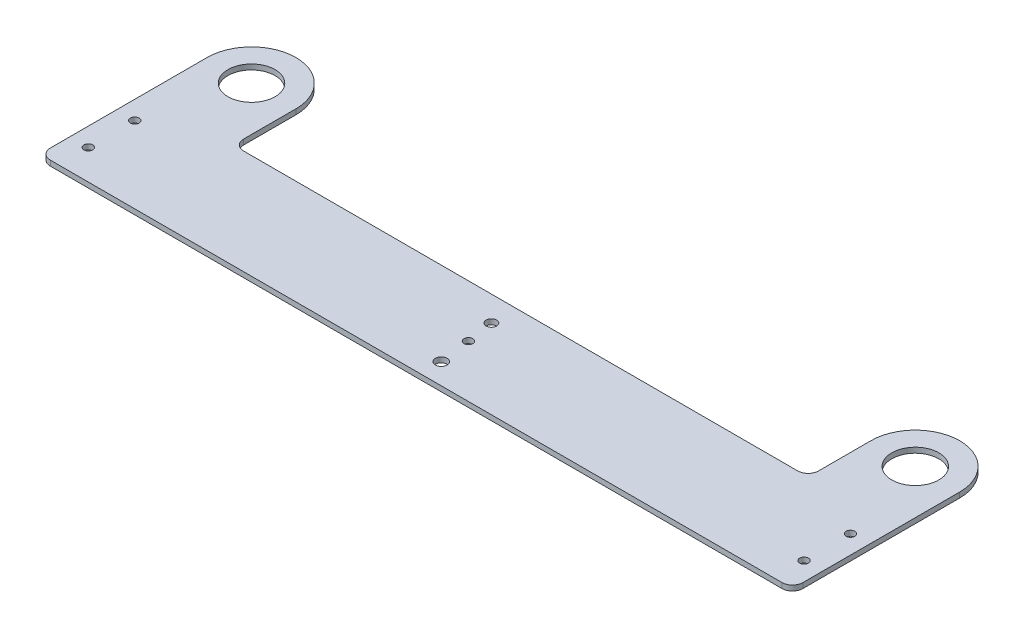
from build123d import *

# Parameters (mm, degrees)
SKETCH1_R           = 14.2875
BOSS_EXTRUDE1_DEPTH = 3.175
CUT_EXTRUDE1_REACH  = 444.058
SKETCH2_R           = 3.556
SKETCH2_R_2         = 3.175
CUT_EXTRUDE2_REACH  = 444.058
SKETCH3_R           = 2.667
CUT_EXTRUDE3_REACH  = 444.058
SKETCH4_R           = 2.667


with BuildPart() as part:
    # Sketch1 → Boss-Extrude1 (new body)
    with BuildSketch(Plane(origin=(0, 0, 0), x_dir=(1, 0, 0), z_dir=(0, 1, 0))):
        with BuildLine():
            Line((-26.9875, 0), (-26.9875, -95.25))
            ThreePointArc((-26.9875, -95.25), (-25.127628061, -99.740128061), (-20.6375, -101.6))
            Line((-20.6375, -101.6), (423.8625, -101.6))
            ThreePointArc((423.8625, -101.6), (428.352628061, -99.740128061), (430.2125, -95.25))
            Line((430.2125, -95.25), (430.2125, 0))
            ThreePointArc((430.2125, 0), (403.225, 26.9875), (376.2375, 0))
            Line((376.2375, 0), (376.2375, -31.75))
            ThreePointArc((376.2375, -31.75), (374.377628061, -36.240128061), (369.8875, -38.1))
            Line((369.8875, -38.1), (33.3375, -38.1))
            ThreePointArc((33.3375, -38.1), (28.847371939, -36.240128061), (26.9875, -31.75))
            Line((26.9875, -31.75), (26.9875, 0))
            ThreePointArc((26.9875, 0), (0, 26.9875), (-26.9875, 0))
        make_face()
        Circle(SKETCH1_R, mode=Mode.SUBTRACT)
        with Locations((403.225, 0)):
            Circle(SKETCH1_R, mode=Mode.SUBTRACT)
    extrude(amount=BOSS_EXTRUDE1_DEPTH)

    # Sketch2 → Cut-Extrude1 (cut, up to next)
    with BuildSketch(Plane(origin=(0, 3.175, 0), x_dir=(1, 0, 0), z_dir=(0, 1, 0)), mode=Mode.PRIVATE) as cut_extrude1_sk1:
        with Locations((204.1525, -88.9)):
            Circle(SKETCH2_R)
    cut_extrude1_tool1 = extrude(cut_extrude1_sk1.sketch, amount=-CUT_EXTRUDE1_REACH, mode=Mode.PRIVATE) & part.part
    # Sketch2 → Cut-Extrude1 (cut, up to next)
    with BuildSketch(Plane(origin=(0, 3.175, 0), x_dir=(1, 0, 0), z_dir=(0, 1, 0)), mode=Mode.PRIVATE) as cut_extrude1_sk2:
        with Locations((199.0725, -53.34)):
            Circle(SKETCH2_R_2)
    cut_extrude1_tool2 = extrude(cut_extrude1_sk2.sketch, amount=-CUT_EXTRUDE1_REACH, mode=Mode.PRIVATE) & part.part
    add(cut_extrude1_tool1.solids().sort_by_distance((204.1525, 3.175, 88.9))[0], mode=Mode.SUBTRACT)
    add(cut_extrude1_tool2.solids().sort_by_distance((199.0725, 3.175, 53.34))[0], mode=Mode.SUBTRACT)

    # Sketch3 → Cut-Extrude2 (cut, up to next)
    with BuildSketch(Plane(origin=(0, 3.175, 0), x_dir=(1, 0, 0), z_dir=(0, 1, 0)), mode=Mode.PRIVATE) as cut_extrude2_sk1:
        with Locations((-15.779743521, -55.159030044)):
            Circle(SKETCH3_R)
    cut_extrude2_tool1 = extrude(cut_extrude2_sk1.sketch, amount=-CUT_EXTRUDE2_REACH, mode=Mode.PRIVATE) & part.part
    # Sketch3 → Cut-Extrude2 (cut, up to next)
    with BuildSketch(Plane(origin=(0, 3.175, 0), x_dir=(1, 0, 0), z_dir=(0, 1, 0)), mode=Mode.PRIVATE) as cut_extrude2_sk2:
        with Locations((419.004743521, -55.159030044)):
            Circle(SKETCH3_R)
    cut_extrude2_tool2 = extrude(cut_extrude2_sk2.sketch, amount=-CUT_EXTRUDE2_REACH, mode=Mode.PRIVATE) & part.part
    # Sketch3 → Cut-Extrude2 (cut, up to next)
    with BuildSketch(Plane(origin=(0, 3.175, 0), x_dir=(1, 0, 0), z_dir=(0, 1, 0)), mode=Mode.PRIVATE) as cut_extrude2_sk3:
        with Locations((-15.779743521, -83.371493131)):
            Circle(SKETCH3_R)
    cut_extrude2_tool3 = extrude(cut_extrude2_sk3.sketch, amount=-CUT_EXTRUDE2_REACH, mode=Mode.PRIVATE) & part.part
    # Sketch3 → Cut-Extrude2 (cut, up to next)
    with BuildSketch(Plane(origin=(0, 3.175, 0), x_dir=(1, 0, 0), z_dir=(0, 1, 0)), mode=Mode.PRIVATE) as cut_extrude2_sk4:
        with Locations((419.004743521, -83.371493131)):
            Circle(SKETCH3_R)
    cut_extrude2_tool4 = extrude(cut_extrude2_sk4.sketch, amount=-CUT_EXTRUDE2_REACH, mode=Mode.PRIVATE) & part.part
    add(cut_extrude2_tool1.solids().sort_by_distance((-15.779744, 3.175, 55.15903))[0], mode=Mode.SUBTRACT)
    add(cut_extrude2_tool2.solids().sort_by_distance((419.004744, 3.175, 55.15903))[0], mode=Mode.SUBTRACT)
    add(cut_extrude2_tool3.solids().sort_by_distance((-15.779744, 3.175, 83.371493))[0], mode=Mode.SUBTRACT)
    add(cut_extrude2_tool4.solids().sort_by_distance((419.004744, 3.175, 83.371493))[0], mode=Mode.SUBTRACT)

    # Sketch4 → Cut-Extrude3 (cut, up to next)
    with BuildSketch(Plane(origin=(0, 3.175, 0), x_dir=(1, 0, 0), z_dir=(0, 1, 0)), mode=Mode.PRIVATE) as cut_extrude3_sk1:
        with Locations((201.6125, -69.85)):
            Circle(SKETCH4_R)
    cut_extrude3_tool1 = extrude(cut_extrude3_sk1.sketch, amount=-CUT_EXTRUDE3_REACH, mode=Mode.PRIVATE) & part.part
    add(cut_extrude3_tool1.solids().sort_by_distance((201.6125, 3.175, 69.85))[0], mode=Mode.SUBTRACT)


solid = part.part
